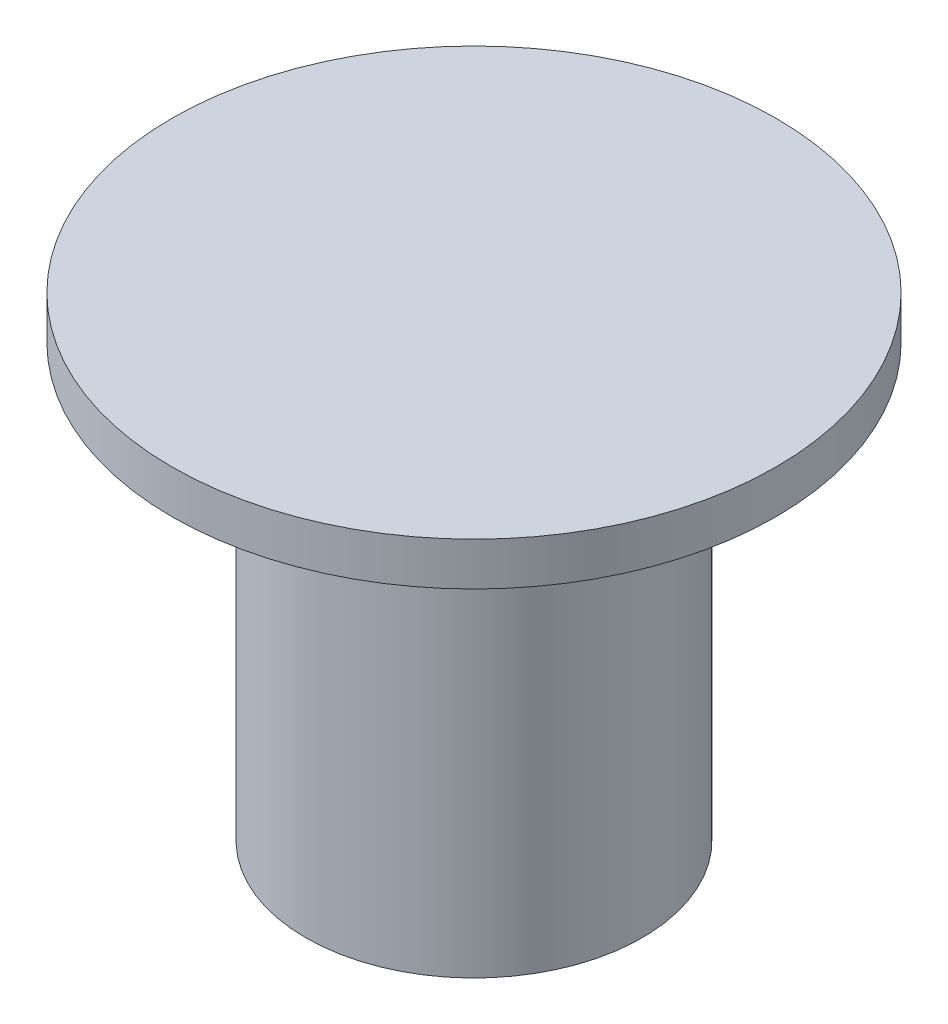
from build123d import *

# Parameters (mm, degrees)
ENL_VEMENT_DE_MATI_RE_BALAYAGE1_PITCH = 0.2


with BuildPart() as part:
    # Esquisse1 → Révolution1 (revolve)
    with BuildSketch(Plane.XY, mode=Mode.PRIVATE) as r_volution1_sk:
        Polygon((0, 0), (3.5, 0), (3.5, -0.5), (1.95, -0.5), (1.95, -5.5), (1.45, -5.5), (1.45, -0.5), (0, -0.5), align=None)
    revolve(r_volution1_sk.sketch.rotate(Axis((0, -0.5, 0), (0, 1, 0)), 90), axis=Axis((0, -0.5, 0), (0, 1, 0)))

    # Enlèvement de matière-Balayage1: arcs per turn and ends read off the stored shape
    # Enlèvement de matière-Balayage1: the profile of Esquisse3 profile screwed along a left-hand helix through 30 turns, 6 arcs to a turn; built about Z, then put on its axis
    enl_vement_de_mati_re_balayage1_z = Axis((0, 0, 0), (0, 0, 1))
    enl_vement_de_mati_re_balayage1_corners = [(1.4497, -5.06e-07, -0.220134989), (1.55, -5.41e-07, -0.174999989), (1.4497, -5.06e-07, -0.129864989)]
    with BuildLine(mode=Mode.PRIVATE) as enl_vement_de_mati_re_balayage1_profile:
        Line(enl_vement_de_mati_re_balayage1_corners[0], enl_vement_de_mati_re_balayage1_corners[1])
        Line(enl_vement_de_mati_re_balayage1_corners[1], enl_vement_de_mati_re_balayage1_corners[2])
        Line(enl_vement_de_mati_re_balayage1_corners[2], enl_vement_de_mati_re_balayage1_corners[0])
    enl_vement_de_mati_re_balayage1_cap = Face(enl_vement_de_mati_re_balayage1_profile.wire())
    enl_vement_de_mati_re_balayage1_turn_angles = [0, -30, -60, -90, -120, -150, -180, -210, -240, -270, -300, -330, -360]
    enl_vement_de_mati_re_balayage1_turn_weights = [1, 0.8660254037844387, 1, 0.8660254037844387, 1, 0.8660254037844387, 1, 0.8660254037844387, 1, 0.8660254037844387, 1, 0.8660254037844387, 1]
    enl_vement_de_mati_re_balayage1_turn_rails = [Edge.make_bspline([Vector(p[0], p[1], 0).rotate(enl_vement_de_mati_re_balayage1_z, enl_vement_de_mati_re_balayage1_turn_angles[k]) / enl_vement_de_mati_re_balayage1_turn_weights[k] + Vector(0, 0, p[2] + -ENL_VEMENT_DE_MATI_RE_BALAYAGE1_PITCH * enl_vement_de_mati_re_balayage1_turn_angles[k] / 360) for k in range(13)], [0, 0, 0, 1, 1, 2, 2, 3, 3, 4, 4, 5, 5, 6, 6, 6], 2, enl_vement_de_mati_re_balayage1_turn_weights) for p in enl_vement_de_mati_re_balayage1_corners]
    enl_vement_de_mati_re_balayage1_turn_sides = [Face.make_surface_from_curves(enl_vement_de_mati_re_balayage1_turn_rails[p[0]], enl_vement_de_mati_re_balayage1_turn_rails[p[1]]) for p in [(0, 1), (1, 2), (2, 0)]]
    enl_vement_de_mati_re_balayage1 = Plane(origin=(0, -0.5, 0), x_dir=(0.7071067811865488, 0, -0.7071067811865462), z_dir=(0, -1, 0)) * Solid(Shell([*[p.moved(Location((0, 0, ENL_VEMENT_DE_MATI_RE_BALAYAGE1_PITCH * i))) for i in range(30) for p in enl_vement_de_mati_re_balayage1_turn_sides], enl_vement_de_mati_re_balayage1_cap, enl_vement_de_mati_re_balayage1_cap.rotate(enl_vement_de_mati_re_balayage1_z, -10800).moved(Location((0, 0, -ENL_VEMENT_DE_MATI_RE_BALAYAGE1_PITCH * -10800 / 360)))]))
    add(enl_vement_de_mati_re_balayage1, mode=Mode.SUBTRACT)


solid = part.part
